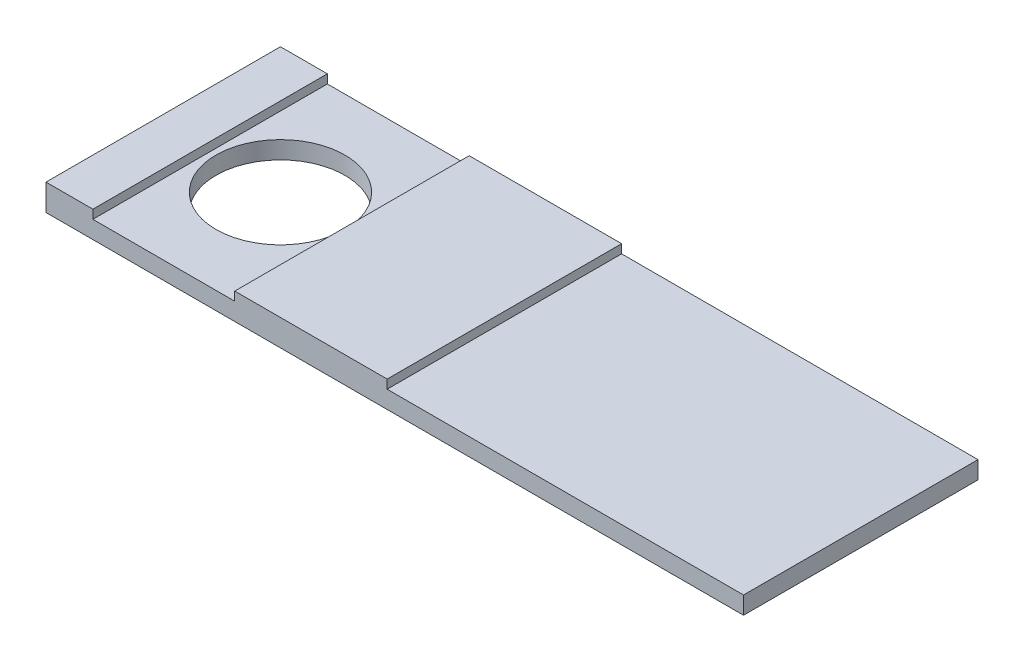
from build123d import *

# Parameters (mm, degrees)
SKETCH1_W           = 119
SKETCH1_H           = 40
SKETCH1_R           = 11
BOSS_EXTRUDE1_DEPTH = 3
SKETCH2_W           = 26
SKETCH2_H           = 40
SKETCH2_W_2         = 8
BOSS_EXTRUDE2_DEPTH = 1.5


with BuildPart() as part:
    # Sketch1 → Boss-Extrude1 (new body)
    with BuildSketch(Plane(origin=(0, 0, 0), x_dir=(1, 0, 0), z_dir=(0, 1, 0))):
        Rectangle(SKETCH1_W, SKETCH1_H)
        with Locations((-39.5, 0)):
            Circle(SKETCH1_R, mode=Mode.SUBTRACT)
    extrude(amount=BOSS_EXTRUDE1_DEPTH)

    # Sketch2 → Boss-Extrude2 (add)
    with BuildSketch(Plane(origin=(0, 3, 0), x_dir=(1, 0, 0), z_dir=(0, 1, 0))):
        with Locations((-14.3, 0)):
            Rectangle(SKETCH2_W, SKETCH2_H)
        with Locations((-55.5, 0)):
            Rectangle(SKETCH2_W_2, SKETCH2_H)
    extrude(amount=BOSS_EXTRUDE2_DEPTH)


solid = part.part
